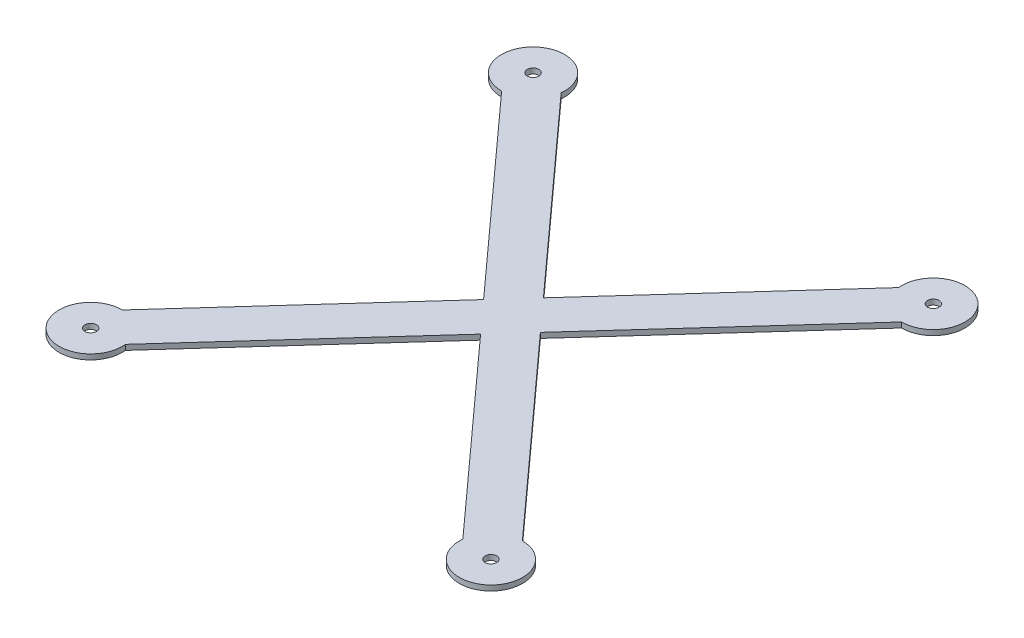
from build123d import *

# Parameters (mm, degrees)
SKETCH1_R           = 3.5
BOSS_EXTRUDE1_DEPTH = 3.175


with BuildPart() as part:
    # Sketch1 → Boss-Extrude1 (new body)
    with BuildSketch(Plane(origin=(0, 0, 0), x_dir=(1, 0, 0), z_dir=(0, 1, 0))):
        with BuildLine():
            Line((101.706176079, 131.341509212), (0, 18.929419861))
            Line((0, 18.929419861), (-101.706176079, 131.341509212))
            ThreePointArc((-101.706176079, 131.341509212), (-133.430898822, 147.476256592), (-120.541184869, 114.300310783))
            Line((-120.541184869, 114.300310783), (-17.12661797, 0))
            Line((-17.12661797, 0), (-120.541184869, -114.300310783))
            ThreePointArc((-120.541184869, -114.300310783), (-133.430898822, -147.476256592), (-101.706176079, -131.341509212))
            Line((-101.706176079, -131.341509212), (0, -18.929419861))
            Line((0, -18.929419861), (101.706176079, -131.341509212))
            ThreePointArc((101.706176079, -131.341509212), (133.430898822, -147.476256592), (120.541184869, -114.300310783))
            Line((120.541184869, -114.300310783), (17.12661797, 0))
            Line((17.12661797, 0), (120.541184869, 114.300310783))
            ThreePointArc((120.541184869, 114.300310783), (133.430898822, 147.476256592), (101.706176079, 131.341509212))
        make_face()
        with Locations((120.65, 133.35)):
            Circle(SKETCH1_R, mode=Mode.SUBTRACT)
        with Locations((120.65, -133.35)):
            Circle(SKETCH1_R, mode=Mode.SUBTRACT)
        with Locations((-120.65, -133.35)):
            Circle(SKETCH1_R, mode=Mode.SUBTRACT)
        with Locations((-120.65, 133.35)):
            Circle(SKETCH1_R, mode=Mode.SUBTRACT)
    extrude(amount=BOSS_EXTRUDE1_DEPTH)


solid = part.part
